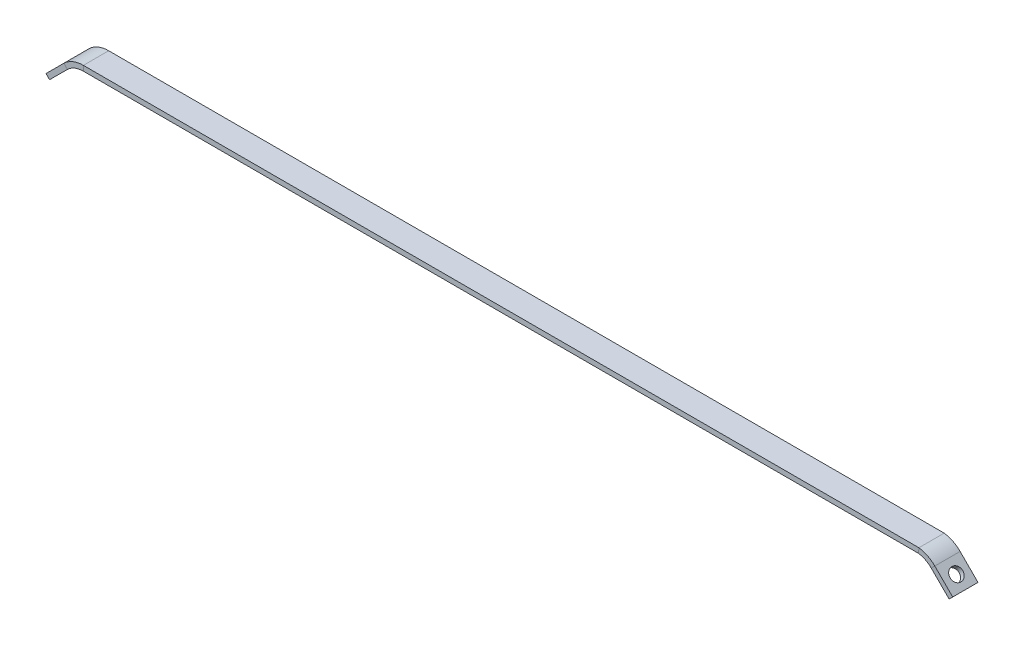
from build123d import *
from OCP.BRepAlgoAPI import BRepAlgoAPI_Cut
from OCP.TopTools import TopTools_ListOfShape

# Parameters (mm, degrees)
SWEEP1_START       = -5
SWEEP1_DEPTH       = 10
SKETCH3_R          = 2.5
CUT_EXTRUDE1_DEPTH = 10
SKETCH6_R          = 2.5
CUT_EXTRUDE2_DEPTH = 2


with BuildPart() as part:
    # Sweep1: read off the stored shape, not the designer's step
    # Sweep1 outline → Sweep1 (new body)
    with BuildSketch(Plane.XY.offset(SWEEP1_START)):
        with BuildLine():
            Line((232.923534553, -10.606601718), (234.337748115, -9.192388155))
            Line((234.337748115, -9.192388155), (227.266680303, -2.121320344))
            add(Edge.make_bspline(
                [(220.973792806, 1.000000004), (220.996623613, 0.996738482), (221.019823203, 0.993424062), (221.32319859, 0.950076613), (221.626964068, 0.894672744), (222.202549229, 0.764511245), (222.487656849, 0.687861068), (223.332329716, 0.423928716), (223.881232147, 0.202580142), (225.463987163, -0.588990805), (226.43267267, -1.28731271), (227.266680303, -2.121320344)],
                knots=[-0.004264936, -0.004264936, -0.004264936, -0.004264936, 0, 0, 0.048942856, 0.048942856, 0.097885713, 0.097885713, 0.195771425, 0.195771425, 0.39154285, 0.39154285, 0.39154285, 0.39154285], degree=3))
            Line((220.973792806, 1.000000004), (-109.309697151, 0.999999892))
            ThreePointArc((-109.309697151, 0.999999892), (-113.470401554, 0.195974843), (-117.018410768, -2.121253679))
            Line((-117.018410768, -2.121253679), (-124.089413627, -9.192388155))
            Line((-124.089413627, -9.192388155), (-122.675200065, -10.606601718))
            Line((-122.675200065, -10.606601718), (-115.609189907, -3.540595572))
            ThreePointArc((-115.609189907, -3.540595572), (-112.70975362, -1.653770585), (-109.312780923, -1.000000132))
            Line((-109.312780923, -1.000000132), (220.829769992, -1))
            ThreePointArc((220.829769992, -1), (223.54434808, -1.865184594), (225.852466741, -3.535533906))
            Line((225.852466741, -3.535533906), (232.923534553, -10.606601718))
        make_face()
    extrude(amount=SWEEP1_DEPTH)


with BuildPart() as cut_extrude1_tool:
    # Sketch3 → Cut-Extrude1 (new body)
    with BuildSketch(Plane(origin=(-56.034299174, 56.034299174, 0), x_dir=(0, 0, -1), z_dir=(0.7071067811865286, -0.7071067811865666, 0))):
        with Locations(Location((0, -89.248043129, 0), (0, 0, 90))):
            Circle(SKETCH3_R)
    extrude(amount=-CUT_EXTRUDE1_DEPTH)


with BuildPart() as part_1:
    add(part.part)

    # Cut-Extrude1: cut by cut_extrude1_tool, with a tolerance
    cut_extrude1_stock = TopTools_ListOfShape()
    cut_extrude1_stock.Append(part_1.part.wrapped)
    cut_extrude1_tools = TopTools_ListOfShape()
    cut_extrude1_tools.Append(cut_extrude1_tool.part.wrapped)
    cut_extrude1_cut = BRepAlgoAPI_Cut()
    cut_extrude1_cut.SetArguments(cut_extrude1_stock)
    cut_extrude1_cut.SetTools(cut_extrude1_tools)
    cut_extrude1_cut.SetFuzzyValue(0.00001)
    cut_extrude1_cut.Build()
    add(Compound.cast(cut_extrude1_cut.Shape()).solids(), mode=Mode.REPLACE)

    # Sketch6 → Cut-Extrude2 (cut)
    with BuildSketch(Plane(origin=(111.158466417, 111.158466417, 0), x_dir=(0, 0, 1), z_dir=(-0.7071067811865477, -0.7071067811865475, 0))):
        with Locations(Location((0, -167.20181078, 0), (0, 0, 270))):
            Circle(SKETCH6_R)
    extrude(amount=-CUT_EXTRUDE2_DEPTH, mode=Mode.SUBTRACT)


solid = part_1.part
